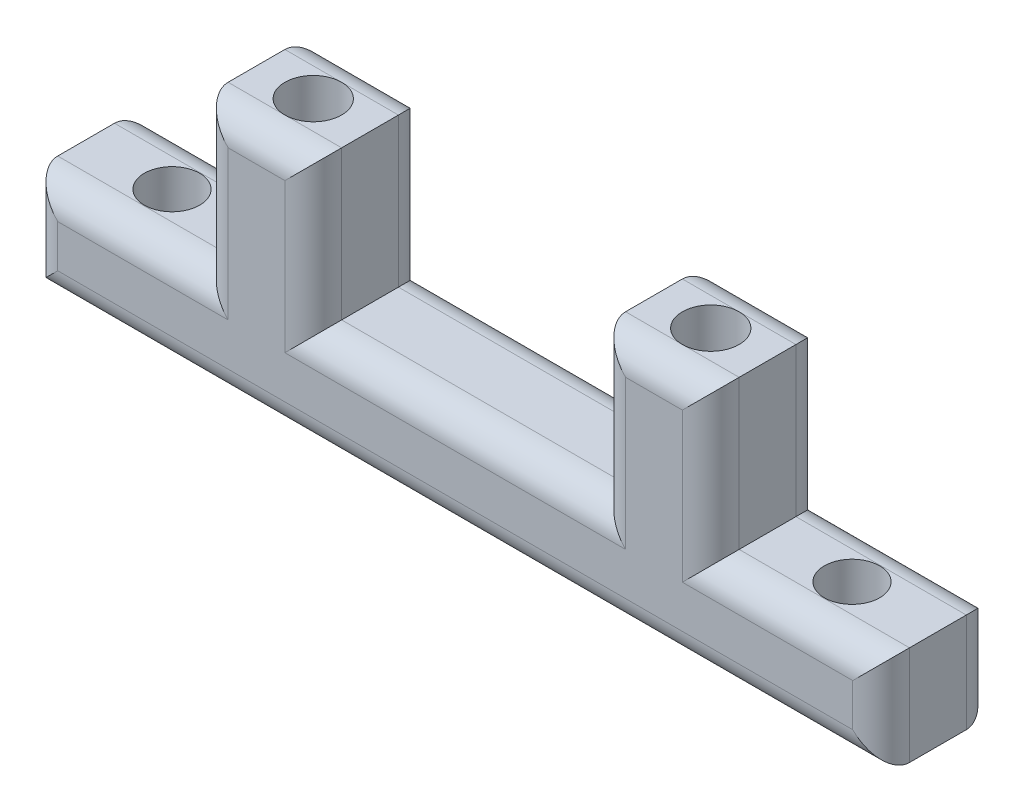
from build123d import *

# Parameters (mm, degrees)
SKETCH1_W           = 60
SKETCH1_H           = 8
BOSS_EXTRUDE1_DEPTH = 7
SKETCH2_W           = 8
SKETCH2_H           = 8
BOSS_EXTRUDE2_DEPTH = 10.5
SKETCH3_R           = 2
CUT_EXTRUDE1_DEPTH  = 35.960692213
SKETCH5_R           = 1.95
CUT_EXTRUDE2_DEPTH  = 35.960692213
FILLET1_R           = 2


with BuildPart() as part:
    # Sketch1 → Boss-Extrude1 (new body)
    with BuildSketch(Plane(origin=(0, 0, 0), x_dir=(1, 0, 0), z_dir=(0, 1, 0))):
        Rectangle(SKETCH1_W, SKETCH1_H)
    extrude(amount=BOSS_EXTRUDE1_DEPTH)

    # Sketch2 → Boss-Extrude2 (add)
    with BuildSketch(Plane(origin=(0, 7, 0), x_dir=(1, 0, 0), z_dir=(0, 1, 0))):
        with Locations((-14, 0)):
            Rectangle(SKETCH2_W, SKETCH2_H)
        with Locations((14, 0)):
            Rectangle(SKETCH2_W, SKETCH2_H)
    extrude(amount=BOSS_EXTRUDE2_DEPTH)

    # Sketch3 → Cut-Extrude1 (cut, through all)
    with BuildSketch(Plane(origin=(0, 17.5, 0), x_dir=(1, 0, 0), z_dir=(0, 1, 0))):
        with Locations((-14, 0)):
            Circle(SKETCH3_R)
        with Locations((14, 0)):
            Circle(SKETCH3_R)
    extrude(amount=-CUT_EXTRUDE1_DEPTH, mode=Mode.SUBTRACT)

    # Sketch5 → Cut-Extrude2 (cut, through all)
    with BuildSketch(Plane.XZ):
        with Locations((-23.95, 0)):
            Circle(SKETCH5_R)
        with Locations((23.95, 0)):
            Circle(SKETCH5_R)
    extrude(amount=-CUT_EXTRUDE2_DEPTH, mode=Mode.SUBTRACT)

    # Fillet1
    fillet1_edges = [part.edges().sort_by_distance(p)[0] for p in [
        (30, 3.5, -4),
        (24, 7, -4),
        (18, 12.25, -4),
        (14, 17.5, -4),
        (10, 12.25, -4),
        (0, 7, -4),
        (-10, 12.25, -4),
        (-14, 17.5, -4),
        (-18, 12.25, -4),
        (-24, 7, -4),
        (-30, 3.5, -4),
        (0, 0, -4),
        (-30, 3.5, 4),
        (-24, 7, 4),
        (-18, 12.25, 4),
        (-14, 17.5, 4),
        (-10, 12.25, 4),
        (0, 7, 4),
        (10, 12.25, 4),
        (14, 17.5, 4),
        (18, 12.25, 4),
        (24, 7, 4),
        (30, 3.5, 4),
        (0, 0, 4),
    ]]
    fillet(fillet1_edges, radius=FILLET1_R)


solid = part.part
